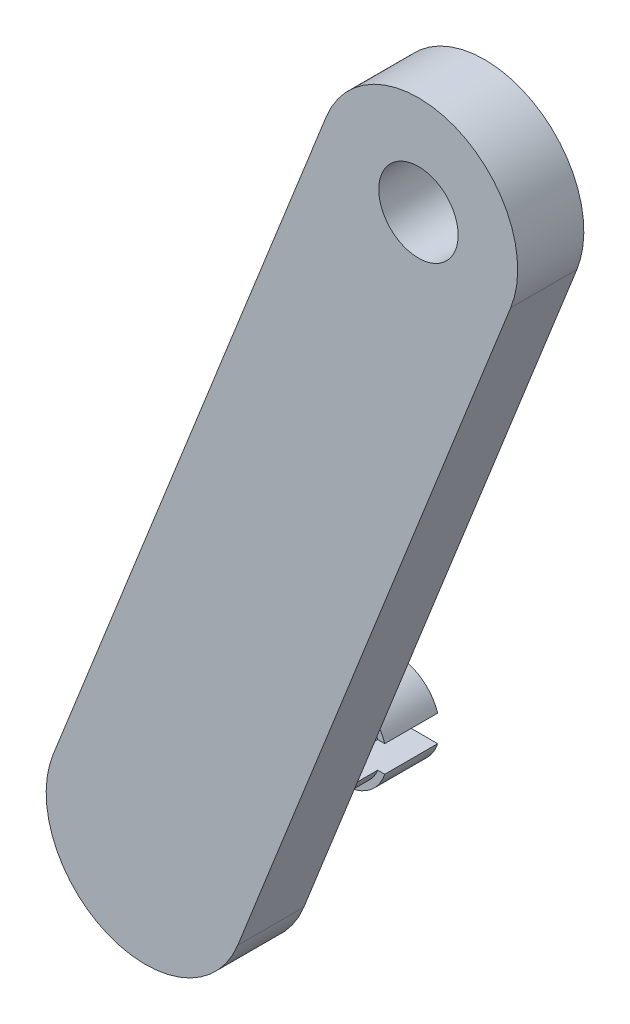
from build123d import *

# Parameters (mm, degrees)
BOSS_EXTRU_1_DEPTH      = 5
ESQUISSE2_R             = 2.75
BOSS_EXTRU_2_DEPTH      = 15
ESQUISSE4_R             = 3.25
BOSS_EXTRU_3_DEPTH      = 4
ESQUISSE5_W             = 10
ESQUISSE5_H             = 2
ENL_V_MAT_EXTRU_2_DEPTH = 14
ESQUISSE6_R             = 3
ENL_V_MAT_EXTRU_3_DEPTH = 14


with BuildPart() as part:
    # Esquisse1 → Boss.-Extru.1 (new body)
    with BuildSketch(Plane.XY):
        with BuildLine():
            Line((-57.027974896, -6.764211633), (-77.667421757, -58.821999075))
            ThreePointArc((-77.667421757, -58.821999075), (-87.403658493, -63.029812545), (-91.611471964, -53.293575808))
            Line((-91.611471964, -53.293575808), (-70.972025104, -1.235788367))
            ThreePointArc((-70.972025104, -1.235788367), (-61.235788367, 2.972025104), (-57.027974896, -6.764211633))
        make_face()
    extrude(amount=BOSS_EXTRU_1_DEPTH)

    # Esquisse2 → Boss.-Extru.2 (add)
    with BuildSketch(Plane.XY.offset(5)):
        with Locations((-84.63944686, -56.057787441)):
            Circle(ESQUISSE2_R)
    extrude(amount=-BOSS_EXTRU_2_DEPTH)

    # Esquisse4 → Boss.-Extru.3 (add)
    with BuildSketch(Plane(origin=(0, 0, -10), x_dir=(-1, 0, 0), z_dir=(0, 0, -1))):
        with Locations((84.63944686, -56.057787441)):
            Circle(ESQUISSE4_R)
    extrude(amount=BOSS_EXTRU_3_DEPTH)

    # Esquisse5 → Enlèv. mat.-Extru.2 (cut)
    with BuildSketch(Plane(origin=(0, 0, -14), x_dir=(-1, 0, 0), z_dir=(0, 0, -1))):
        with Locations((84.63944686, -56.057787441)):
            Rectangle(ESQUISSE5_W, ESQUISSE5_H)
    extrude(amount=-ENL_V_MAT_EXTRU_2_DEPTH, mode=Mode.SUBTRACT)

    # Esquisse6 → Enlèv. mat.-Extru.3 (cut)
    with BuildSketch(Plane.XY.offset(5)):
        with Locations((-64, -4)):
            Circle(ESQUISSE6_R)
    extrude(amount=-ENL_V_MAT_EXTRU_3_DEPTH, mode=Mode.SUBTRACT)


solid = part.part
